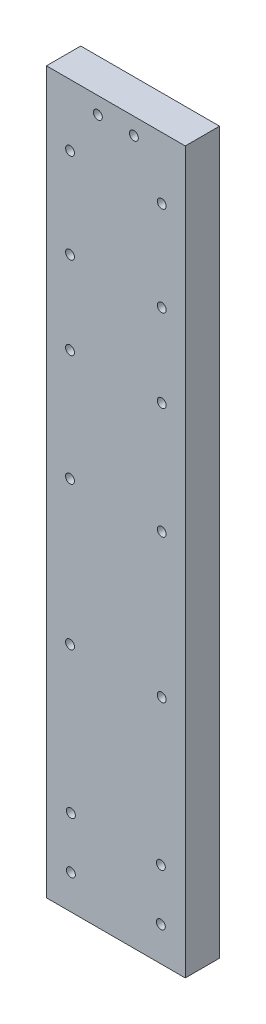
from build123d import *

# Parameters (mm, degrees)
SKETCH1_W           = 16.2
SKETCH1_H           = 84.09
SKETCH1_R           = 0.519960121
BOSS_EXTRUDE1_DEPTH = 4


with BuildPart() as part:
    # Sketch1 → Boss-Extrude1 (new body)
    with BuildSketch(Plane.XY):
        with Locations((8.1, 42.045)):
            Rectangle(SKETCH1_W, SKETCH1_H)
        with Locations((13.45, 43.74)):
            Circle(SKETCH1_R, mode=Mode.SUBTRACT)
        with Locations((2.75, 66.385)):
            Circle(SKETCH1_R, mode=Mode.SUBTRACT)
        with Locations((13.45, 56.74)):
            Circle(SKETCH1_R, mode=Mode.SUBTRACT)
        with Locations((13.45, 76.885)):
            Circle(SKETCH1_R, mode=Mode.SUBTRACT)
        with Locations((2.75, 27)):
            Circle(SKETCH1_R, mode=Mode.SUBTRACT)
        with Locations((2.75, 76.885)):
            Circle(SKETCH1_R, mode=Mode.SUBTRACT)
        with Locations((2.75, 56.74)):
            Circle(SKETCH1_R, mode=Mode.SUBTRACT)
        with Locations((2.85, 10)):
            Circle(SKETCH1_R, mode=Mode.SUBTRACT)
        with Locations((13.35, 10)):
            Circle(SKETCH1_R, mode=Mode.SUBTRACT)
        with Locations((13.35, 4)):
            Circle(SKETCH1_R, mode=Mode.SUBTRACT)
        with Locations((2.85, 4)):
            Circle(SKETCH1_R, mode=Mode.SUBTRACT)
        with Locations((6, 82.135)):
            Circle(SKETCH1_R, mode=Mode.SUBTRACT)
        with Locations((13.45, 27)):
            Circle(SKETCH1_R, mode=Mode.SUBTRACT)
        with Locations((13.45, 66.385)):
            Circle(SKETCH1_R, mode=Mode.SUBTRACT)
        with Locations((10.2, 82.135)):
            Circle(SKETCH1_R, mode=Mode.SUBTRACT)
        with Locations((2.75, 43.74)):
            Circle(SKETCH1_R, mode=Mode.SUBTRACT)
    extrude(amount=BOSS_EXTRUDE1_DEPTH)


solid = part.part
